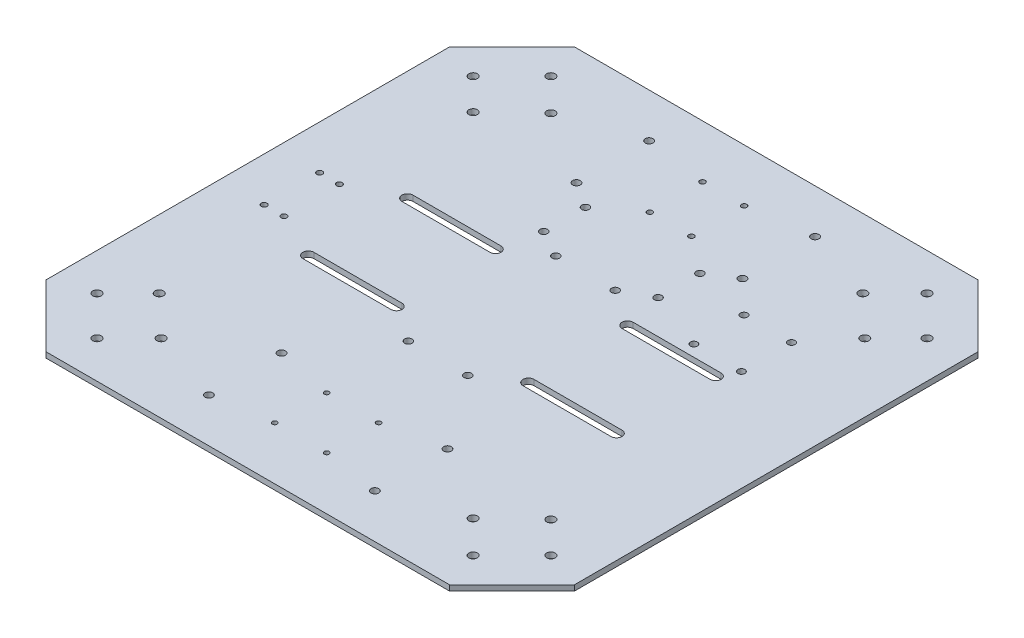
from build123d import *

# Parameters (mm, degrees)
BOSS_EXTRUDE1_DEPTH = 3.175
SKETCH2_R           = 2.4638
CUT_EXTRUDE1_DEPTH  = 6.35
SKETCH3_R           = 2.159
CUT_EXTRUDE2_DEPTH  = 6.35
SKETCH4_R           = 2.2225
CUT_EXTRUDE3_DEPTH  = 351.937720963
SKETCH5_R           = 1.651
CUT_EXTRUDE4_DEPTH  = 351.937720963
SKETCH6_R           = 2.032
SKETCH6_R_2         = 2.159
SKETCH6_R_3         = 1.397
SKETCH6_R_4         = 1.5499969
CUT_EXTRUDE5_DEPTH  = 351.937720963


with BuildPart() as part:
    # Sketch1 → Boss-Extrude1 (new body)
    with BuildSketch(Plane(origin=(0, 0, 0), x_dir=(1, 0, 0), z_dir=(0, 1, 0))):
        Polygon((-25.845025354, 51.656360067), (-61.766049839, 15.735335583), (-61.766049839, -217.222615449), (-25.845025354, -253.143639933), (207.112925677, -253.143639933), (243.033950161, -217.222615449), (243.033950161, 15.735335583), (207.112925677, 51.656360067), align=None)
        with BuildLine():
            ThreePointArc((52.533950161, -126.143639933), (55.708950161, -129.318639933), (52.533950161, -132.493639933))
            Line((52.533950161, -132.493639933), (1.733950161, -132.493639933))
            ThreePointArc((1.733950161, -132.493639933), (-1.441049839, -129.318639933), (1.733950161, -126.143639933))
            Line((1.733950161, -126.143639933), (52.533950161, -126.143639933))
        make_face(mode=Mode.SUBTRACT)
        with BuildLine():
            Line((179.533950161, -132.493639933), (128.733950161, -132.493639933))
            ThreePointArc((128.733950161, -132.493639933), (125.558950161, -129.318639933), (128.733950161, -126.143639933))
            Line((128.733950161, -126.143639933), (179.533950161, -126.143639933))
            ThreePointArc((179.533950161, -126.143639933), (182.708950161, -129.318639933), (179.533950161, -132.493639933))
        make_face(mode=Mode.SUBTRACT)
        with BuildLine():
            Line((1.733950161, -68.993639933), (52.533950161, -68.993639933))
            ThreePointArc((52.533950161, -68.993639933), (55.708950161, -72.168639933), (52.533950161, -75.343639933))
            Line((52.533950161, -75.343639933), (1.733950161, -75.343639933))
            ThreePointArc((1.733950161, -75.343639933), (-1.441049839, -72.168639933), (1.733950161, -68.993639933))
        make_face(mode=Mode.SUBTRACT)
        with BuildLine():
            ThreePointArc((128.733950161, -75.343639933), (125.558950161, -72.168639933), (128.733950161, -68.993639933))
            Line((128.733950161, -68.993639933), (179.533950161, -68.993639933))
            ThreePointArc((179.533950161, -68.993639933), (182.708950161, -72.168639933), (179.533950161, -75.343639933))
            Line((179.533950161, -75.343639933), (128.733950161, -75.343639933))
        make_face(mode=Mode.SUBTRACT)
    extrude(amount=BOSS_EXTRUDE1_DEPTH)

    # Sketch2 → Cut-Extrude1 (cut)
    with BuildSketch(Plane(origin=(0, 3.175, 0), x_dir=(1, 0, 0), z_dir=(0, 1, 0))):
        with Locations((-17.872380726, 30.213331256)):
            Circle(SKETCH2_R)
        with Locations((0.640891541, 11.70005899)):
            Circle(SKETCH2_R)
        with Locations((-22.362508786, -10.197821288)):
            Circle(SKETCH2_R)
        with Locations((-40.323021028, 7.762690954)):
            Circle(SKETCH2_R)
        with Locations((203.630409109, -10.197821288)):
            Circle(SKETCH2_R)
        with Locations((221.590921351, 7.762690954)):
            Circle(SKETCH2_R)
        with Locations((180.627008782, 11.70005899)):
            Circle(SKETCH2_R)
        with Locations((199.140281048, 30.213331256)):
            Circle(SKETCH2_R)
        with Locations((-22.362508786, -191.289458578)):
            Circle(SKETCH2_R)
        with Locations((-40.323021028, -209.24997082)):
            Circle(SKETCH2_R)
        with Locations((-17.872380726, -231.700611123)):
            Circle(SKETCH2_R)
        with Locations((0.640891541, -213.187338857)):
            Circle(SKETCH2_R)
        with Locations((221.590921351, -209.24997082)):
            Circle(SKETCH2_R)
        with Locations((199.140281048, -231.700611123)):
            Circle(SKETCH2_R)
        with Locations((180.627008782, -213.187338857)):
            Circle(SKETCH2_R)
        with Locations((203.630409109, -191.289458578)):
            Circle(SKETCH2_R)
    extrude(amount=-CUT_EXTRUDE1_DEPTH, mode=Mode.SUBTRACT)

    # Sketch3 → Cut-Extrude2 (cut)
    with BuildSketch(Plane(origin=(0, 3.175, 0), x_dir=(1, 0, 0), z_dir=(0, 1, 0))):
        with Locations((73.361950161, -58.198639933)):
            Circle(SKETCH3_R)
        with Locations((107.651950161, -58.198639933)):
            Circle(SKETCH3_R)
        with Locations((73.361950161, -143.288639933)):
            Circle(SKETCH3_R)
        with Locations((107.651950161, -143.288639933)):
            Circle(SKETCH3_R)
    extrude(amount=-CUT_EXTRUDE2_DEPTH, mode=Mode.SUBTRACT)

    # Sketch4 → Cut-Extrude3 (cut, through all)
    with BuildSketch(Plane(origin=(0, 3.175, 0), x_dir=(1, 0, 0), z_dir=(0, 1, 0))):
        with Locations((42.754950161, 26.256360067)):
            Circle(SKETCH4_R)
        with Locations((138.512950161, 26.256360067)):
            Circle(SKETCH4_R)
        with Locations((42.754950161, -15.653639933)):
            Circle(SKETCH4_R)
        with Locations((138.512950161, -15.653639933)):
            Circle(SKETCH4_R)
        with Locations((138.512950161, -185.833639933)):
            Circle(SKETCH4_R)
        with Locations((42.754950161, -185.833639933)):
            Circle(SKETCH4_R)
        with Locations((138.512950161, -227.743639933)):
            Circle(SKETCH4_R)
        with Locations((42.754950161, -227.743639933)):
            Circle(SKETCH4_R)
    extrude(amount=-CUT_EXTRUDE3_DEPTH, mode=Mode.SUBTRACT)

    # Sketch5 → Cut-Extrude4 (cut, through all)
    with BuildSketch(Plane(origin=(0, 3.175, 0), x_dir=(1, 0, 0), z_dir=(0, 1, 0))):
        with Locations((-36.366049839, -84.741639933)):
            Circle(SKETCH5_R)
        with Locations((-24.936049839, -84.741639933)):
            Circle(SKETCH5_R)
        with Locations((-24.936049839, -116.745639933)):
            Circle(SKETCH5_R)
        with Locations((-36.366049839, -116.745639933)):
            Circle(SKETCH5_R)
    extrude(amount=-CUT_EXTRUDE4_DEPTH, mode=Mode.SUBTRACT)

    # Sketch6 → Cut-Extrude5 (cut, through all)
    with BuildSketch(Plane(origin=(0, 3.175, 0), x_dir=(1, 0, 0), z_dir=(0, 1, 0))):
        with Locations((157.181950161, -33.433639933)):
            Circle(SKETCH6_R)
        with Locations((157.181950161, -62.389639933)):
            Circle(SKETCH6_R)
        with Locations((184.613950161, -62.389639933)):
            Circle(SKETCH6_R)
        with Locations((184.613950161, -33.433639933)):
            Circle(SKETCH6_R)
        with Locations((57.613950161, -25.335326073)):
            Circle(SKETCH6_R_2)
        with Locations((57.613950161, -49.465326073)):
            Circle(SKETCH6_R_2)
        with Locations((123.653950161, -49.465326073)):
            Circle(SKETCH6_R_2)
        with Locations((123.653950161, -25.335326073)):
            Circle(SKETCH6_R_2)
        with Locations((75.647950161, -192.691639933)):
            Circle(SKETCH6_R_3)
        with Locations((75.647950161, -222.663639933)):
            Circle(SKETCH6_R_3)
        with Locations((105.619950161, -222.663639933)):
            Circle(SKETCH6_R_3)
        with Locations((105.619950161, -192.691639933)):
            Circle(SKETCH6_R_3)
        with Locations((78.633948761, 21.176360067)):
            Circle(SKETCH6_R_4)
        with Locations((78.633948761, -9.223629933)):
            Circle(SKETCH6_R_4)
        with Locations((102.633951561, -9.223629933)):
            Circle(SKETCH6_R_4)
        with Locations((102.633951561, 21.176360067)):
            Circle(SKETCH6_R_4)
    extrude(amount=-CUT_EXTRUDE5_DEPTH, mode=Mode.SUBTRACT)


solid = part.part
